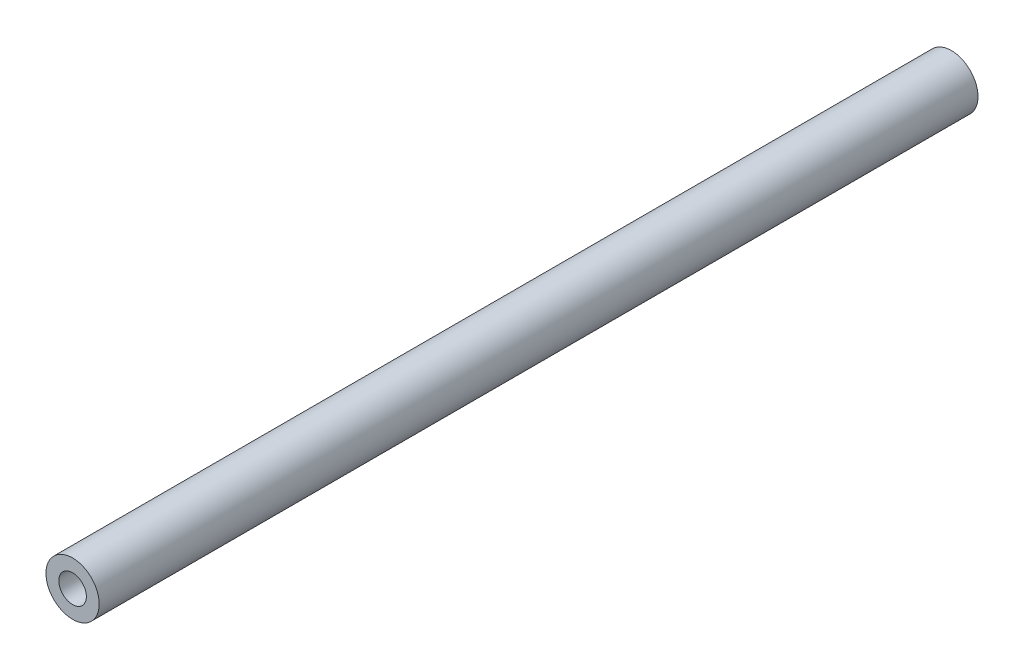
from build123d import *

# Parameters (mm, degrees)
SKETCH1_R                      = 5
BOSS_EXTRUDE1_DEPTH            = 165
F_6_0_204_DIAMETER_HOLE1_D     = 5.1816
F_6_0_204_DIAMETER_HOLE1_DEPTH = 30
F_6_0_204_DIAMETER_HOLE1_TIP   = 1.556709692
F_6_0_204_DIAMETER_HOLE2_D     = 5.1816
F_6_0_204_DIAMETER_HOLE2_DEPTH = 30
F_6_0_204_DIAMETER_HOLE2_TIP   = 1.556709692


with BuildPart() as part:
    # Sketch1 → Boss-Extrude1 (new body)
    with BuildSketch(Plane.XY):
        Circle(SKETCH1_R)
    extrude(amount=BOSS_EXTRUDE1_DEPTH)

    # #6 (0.204) Diameter Hole1
    with Locations(Plane(origin=(0, 0, 0), x_dir=(-1, 0, 0), z_dir=(0, 0, -1))):
        with Locations((0, 0)):
            Hole(F_6_0_204_DIAMETER_HOLE1_D / 2, depth=F_6_0_204_DIAMETER_HOLE1_DEPTH)
            with Locations((0, 0, -(F_6_0_204_DIAMETER_HOLE1_DEPTH + F_6_0_204_DIAMETER_HOLE1_TIP / 2))):  # 118° drill point
                Cone(0, F_6_0_204_DIAMETER_HOLE1_D / 2, F_6_0_204_DIAMETER_HOLE1_TIP, mode=Mode.SUBTRACT)

    # #6 (0.204) Diameter Hole2
    with Locations(Plane.XY.offset(165)):
        with Locations((0, 0)):
            Hole(F_6_0_204_DIAMETER_HOLE2_D / 2, depth=F_6_0_204_DIAMETER_HOLE2_DEPTH)
            with Locations((0, 0, -(F_6_0_204_DIAMETER_HOLE2_DEPTH + F_6_0_204_DIAMETER_HOLE2_TIP / 2))):  # 118° drill point
                Cone(0, F_6_0_204_DIAMETER_HOLE2_D / 2, F_6_0_204_DIAMETER_HOLE2_TIP, mode=Mode.SUBTRACT)


solid = part.part
